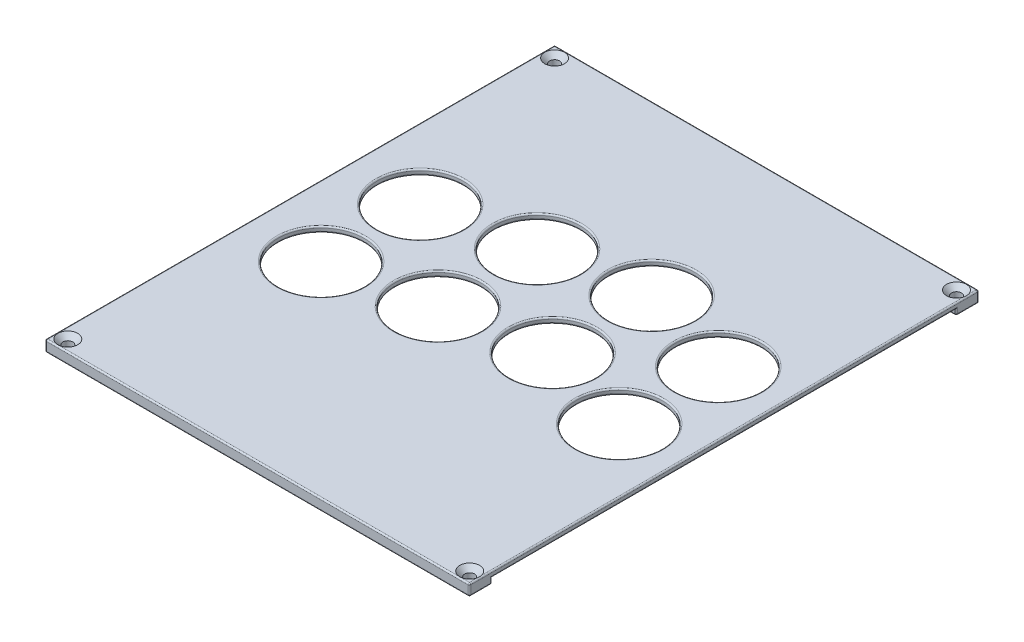
from build123d import *

# Parameters (mm, degrees)
SKETCH1_W           = 150
SKETCH1_H           = 180
SKETCH1_R           = 15.2
SKETCH1_R_2         = 1.75
BOSS_EXTRUDE1_DEPTH = 2
BOSS_EXTRUDE2_START = -2
SKETCH1_4_R         = 1.75
BOSS_EXTRUDE2_DEPTH = 2
BOSS_EXTRUDE3_DEPTH = 4
CUT_EXTRUDE1_DEPTH  = 0.1
FILLET1_R           = 0.5


with BuildPart() as part:
    # Sketch1 → Boss-Extrude1 (new body)
    with BuildSketch(Plane(origin=(0, 0, 0), x_dir=(1, 0, 0), z_dir=(0, 1, 0))):
        with Locations((-75, -90)):
            Rectangle(SKETCH1_W, SKETCH1_H)
        with Locations(Location((-125, -72.5, 0), (0, 0, 270))):
            Circle(SKETCH1_R, mode=Mode.SUBTRACT)
        with Locations(Location((-90.707143601, -65.5, 0), (0, 0, 270))):
            Circle(SKETCH1_R, mode=Mode.SUBTRACT)
        with Locations(Location((-56.225264302, -59.5, 0), (0, 0, 270))):
            Circle(SKETCH1_R, mode=Mode.SUBTRACT)
        with Locations(Location((-22.684244639, -69.5, 0), (0, 0, 270))):
            Circle(SKETCH1_R, mode=Mode.SUBTRACT)
        with Locations(Location((-22.684244639, -104.5, 0), (0, 0, 270))):
            Circle(SKETCH1_R, mode=Mode.SUBTRACT)
        with Locations(Location((-56.225264302, -94.5, 0), (0, 0, 270))):
            Circle(SKETCH1_R, mode=Mode.SUBTRACT)
        with Locations(Location((-90.707143601, -100.5, 0), (0, 0, 270))):
            Circle(SKETCH1_R, mode=Mode.SUBTRACT)
        with Locations(Location((-125, -107.5, 0), (0, 0, 270))):
            Circle(SKETCH1_R, mode=Mode.SUBTRACT)
        with Locations(Location((-146, -4, 0), (0, 0, 270))):
            Circle(SKETCH1_R_2, mode=Mode.SUBTRACT)
        with Locations(Location((-4, -4, 0), (0, 0, 270))):
            Circle(SKETCH1_R_2, mode=Mode.SUBTRACT)
        with Locations(Location((-4, -176, 0), (0, 0, 270))):
            Circle(SKETCH1_R_2, mode=Mode.SUBTRACT)
        with Locations(Location((-146, -176, 0), (0, 0, 270))):
            Circle(SKETCH1_R_2, mode=Mode.SUBTRACT)
    extrude(amount=BOSS_EXTRUDE1_DEPTH)

    # Sketch1<4> → Boss-Extrude2 (add)
    with BuildSketch(Plane(origin=(0, 0, 0), x_dir=(1, 0, 0), z_dir=(0, 1, 0)).offset(BOSS_EXTRUDE2_START)):
        Polygon((0, -8), (0, 0), (-150, 0), (-150, -180), (0, -180), (0, -172), (-8, -172), (-8, -178), (-142, -178), (-142, -172), (-148, -172), (-148, -8), (-142, -8), (-142, -2), (-8, -2), (-8, -8), align=None)
        with Locations((-146, -176)):
            Circle(SKETCH1_4_R, mode=Mode.SUBTRACT)
        with Locations((-4, -176)):
            Circle(SKETCH1_4_R, mode=Mode.SUBTRACT)
        with Locations((-146, -4)):
            Circle(SKETCH1_4_R, mode=Mode.SUBTRACT)
        with Locations((-4, -4)):
            Circle(SKETCH1_4_R, mode=Mode.SUBTRACT)
    extrude(amount=BOSS_EXTRUDE2_DEPTH)

    # Sketch1<5> → Boss-Extrude3 (add)
    with BuildSketch(Plane(origin=(0, 0, 0), x_dir=(1, 0, 0), z_dir=(0, 1, 0))):
        Polygon((-145.7, -90), (-145.7, -80), (-143.7, -80), (-143.7, -100), (-145.7, -100), align=None)
        Polygon((-75, -2.3), (-65, -2.3), (-65, -4.3), (-85, -4.3), (-85, -2.3), align=None)
        Polygon((-75, -177.7), (-65, -177.7), (-65, -175.7), (-85, -175.7), (-85, -177.7), align=None)
    extrude(amount=-BOSS_EXTRUDE3_DEPTH)

    # Sketch2 → Cut-Extrude1 (cut)
    with BuildSketch(Plane(origin=(0, 0, 0), x_dir=(0, 0, -1), z_dir=(1, 0, 0))):
        Polygon((-172, -2), (-172, 0), (-8, 0), (-8, -2), (0, -2), (0, 2), (-180, 2), (-180, -2), align=None)
    extrude(amount=-CUT_EXTRUDE1_DEPTH, mode=Mode.SUBTRACT)

    # Fillet1
    # the kernel refuses this fillet: 0.5 mm, written as the material it takes off along each edge
    with BuildSketch(Plane(origin=(-142.5, -1.5, 172.5), x_dir=(0, 0, -1), z_dir=(0, -1, 0))) as fillet1_piece_1_section:
        Polygon((0, 0), (FILLET1_R, 0), (FILLET1_R, FILLET1_R), (0, FILLET1_R), align=None)
    fillet1_piece_1 = extrude(amount=FILLET1_R, mode=Mode.PRIVATE)
    fillet1_piece_1 = fillet1_piece_1 - Plane(origin=(-142.5, -1.5, 172.5), x_dir=(-0.7071067811865492, 0, 0.7071067811865459), z_dir=(0, -1, 0)) * Sphere(FILLET1_R, mode=Mode.PRIVATE)
    add(fillet1_piece_1, mode=Mode.SUBTRACT)
    with BuildSketch(Plane(origin=(-7.5, -1.5, 172.5), x_dir=(0, -1, 0), z_dir=(-1, 0, 0))) as fillet1_piece_2_section:
        Polygon((0, 0), (FILLET1_R, 0), (FILLET1_R, -FILLET1_R), (0, -FILLET1_R), align=None)
    fillet1_piece_2 = extrude(amount=FILLET1_R, mode=Mode.PRIVATE)
    fillet1_piece_2 = fillet1_piece_2 - Plane(origin=(-7.5, -1.5, 172.5), x_dir=(0, 0.7071067811865475, 0.7071067811865475), z_dir=(-1, 0, 0)) * Sphere(FILLET1_R, mode=Mode.PRIVATE)
    add(fillet1_piece_2, mode=Mode.SUBTRACT)
    with BuildSketch(Plane(origin=(-149.5, -1.5, 0.5), x_dir=(0, -1, 0), z_dir=(0, 0, -1))) as fillet1_piece_3_section:
        Polygon((0, 0), (FILLET1_R, 0), (FILLET1_R, FILLET1_R), (0, FILLET1_R), align=None)
    fillet1_piece_3 = extrude(amount=FILLET1_R, mode=Mode.PRIVATE)
    fillet1_piece_3 = fillet1_piece_3 - Plane(origin=(-149.5, -1.5, 0.5), x_dir=(0.7071067811865475, 0.7071067811865475, 0), z_dir=(0, 0, -1)) * Sphere(FILLET1_R, mode=Mode.PRIVATE)
    add(fillet1_piece_3, mode=Mode.SUBTRACT)
    with BuildSketch(Plane(origin=(-149.5, -1.5, 179.5), x_dir=(0, -1, 0), z_dir=(0, 0, 1))) as fillet1_piece_4_section:
        Polygon((0, 0), (FILLET1_R, 0), (FILLET1_R, -FILLET1_R), (0, -FILLET1_R), align=None)
    fillet1_piece_4 = extrude(amount=FILLET1_R, mode=Mode.PRIVATE)
    fillet1_piece_4 = fillet1_piece_4 - Plane(origin=(-149.5, -1.5, 179.5), x_dir=(0.7071067811865475, 0.7071067811865475, 0), z_dir=(0, 0, 1)) * Sphere(FILLET1_R, mode=Mode.PRIVATE)
    add(fillet1_piece_4, mode=Mode.SUBTRACT)
    with BuildSketch(Plane(origin=(-7.5, -1.5, 7.5), x_dir=(0, -1, 0), z_dir=(-1, 0, 0))) as fillet1_piece_5_section:
        Polygon((0, 0), (FILLET1_R, 0), (FILLET1_R, FILLET1_R), (0, FILLET1_R), align=None)
    fillet1_piece_5 = extrude(amount=FILLET1_R, mode=Mode.PRIVATE)
    fillet1_piece_5 = fillet1_piece_5 - Plane(origin=(-7.5, -1.5, 7.5), x_dir=(0, 0.7071067811865475, -0.7071067811865475), z_dir=(-1, 0, 0)) * Sphere(FILLET1_R, mode=Mode.PRIVATE)
    add(fillet1_piece_5, mode=Mode.SUBTRACT)
    with BuildSketch(Plane(origin=(-0.6, -1.5, 7.5), x_dir=(0, -1, 0), z_dir=(1, 0, 0))) as fillet1_piece_6_section:
        Polygon((0, 0), (FILLET1_R, 0), (FILLET1_R, -FILLET1_R), (0, -FILLET1_R), align=None)
    fillet1_piece_6 = extrude(amount=FILLET1_R, mode=Mode.PRIVATE)
    fillet1_piece_6 = fillet1_piece_6 - Plane(origin=(-0.6, -1.5, 7.5), x_dir=(0, 0.7071067811865475, -0.7071067811865475), z_dir=(1, 0, 0)) * Sphere(FILLET1_R, mode=Mode.PRIVATE)
    add(fillet1_piece_6, mode=Mode.SUBTRACT)
    with BuildSketch(Plane(origin=(-142.5, -1.5, 7.5), x_dir=(1, 0, 0), z_dir=(0, -1, 0))) as fillet1_piece_7_section:
        Polygon((0, 0), (FILLET1_R, 0), (FILLET1_R, FILLET1_R), (0, FILLET1_R), align=None)
    fillet1_piece_7 = extrude(amount=FILLET1_R, mode=Mode.PRIVATE)
    fillet1_piece_7 = fillet1_piece_7 - Plane(origin=(-142.5, -1.5, 7.5), x_dir=(-0.7071067811865475, 0, -0.7071067811865475), z_dir=(0, -1, 0)) * Sphere(FILLET1_R, mode=Mode.PRIVATE)
    add(fillet1_piece_7, mode=Mode.SUBTRACT)
    with BuildSketch(Plane(origin=(-0.6, -1.5, 172.5), x_dir=(0, -1, 0), z_dir=(1, 0, 0))) as fillet1_piece_8_section:
        Polygon((0, 0), (FILLET1_R, 0), (FILLET1_R, FILLET1_R), (0, FILLET1_R), align=None)
    fillet1_piece_8 = extrude(amount=FILLET1_R, mode=Mode.PRIVATE)
    fillet1_piece_8 = fillet1_piece_8 - Plane(origin=(-0.6, -1.5, 172.5), x_dir=(0, 0.7071067811865475, 0.7071067811865475), z_dir=(1, 0, 0)) * Sphere(FILLET1_R, mode=Mode.PRIVATE)
    add(fillet1_piece_8, mode=Mode.SUBTRACT)
    with BuildSketch(Plane(origin=(-0.6, -1.5, 179.5), x_dir=(1, 0, 0), z_dir=(0, 0, 1))) as fillet1_piece_9_section:
        Polygon((0, 0), (FILLET1_R, 0), (FILLET1_R, -FILLET1_R), (0, -FILLET1_R), align=None)
    fillet1_piece_9 = extrude(amount=FILLET1_R, mode=Mode.PRIVATE)
    fillet1_piece_9 = fillet1_piece_9 - Plane(origin=(-0.6, -1.5, 179.5), x_dir=(-0.7071067811865475, 0.7071067811865475, 0), z_dir=(0, 0, 1)) * Sphere(FILLET1_R, mode=Mode.PRIVATE)
    add(fillet1_piece_9, mode=Mode.SUBTRACT)
    with BuildSketch(Plane(origin=(-0.6, -1.5, 0.5), x_dir=(1, 0, 0), z_dir=(0, 0, -1))) as fillet1_piece_10_section:
        Polygon((0, 0), (FILLET1_R, 0), (FILLET1_R, FILLET1_R), (0, FILLET1_R), align=None)
    fillet1_piece_10 = extrude(amount=FILLET1_R, mode=Mode.PRIVATE)
    fillet1_piece_10 = fillet1_piece_10 - Plane(origin=(-0.6, -1.5, 0.5), x_dir=(-0.7071067811865475, 0.7071067811865475, 0), z_dir=(0, 0, -1)) * Sphere(FILLET1_R, mode=Mode.PRIVATE)
    add(fillet1_piece_10, mode=Mode.SUBTRACT)
    with BuildSketch(Plane(origin=(-0.6, 1.5, 0.5), x_dir=(1, 0, 0), z_dir=(0, 0, -1))) as fillet1_piece_11_section:
        Polygon((0, 0), (FILLET1_R, 0), (FILLET1_R, -FILLET1_R), (0, -FILLET1_R), align=None)
    fillet1_piece_11 = extrude(amount=FILLET1_R, mode=Mode.PRIVATE)
    fillet1_piece_11 = fillet1_piece_11 - Plane(origin=(-0.6, 1.5, 0.5), x_dir=(-0.7071067811865475, -0.7071067811865475, 0), z_dir=(0, 0, -1)) * Sphere(FILLET1_R, mode=Mode.PRIVATE)
    add(fillet1_piece_11, mode=Mode.SUBTRACT)
    with BuildSketch(Plane(origin=(-149.5, 1.5, 0.5), x_dir=(-1, 0, 0), z_dir=(0, 0, -1))) as fillet1_piece_12_section:
        Polygon((0, 0), (FILLET1_R, 0), (FILLET1_R, FILLET1_R), (0, FILLET1_R), align=None)
    fillet1_piece_12 = extrude(amount=FILLET1_R, mode=Mode.PRIVATE)
    fillet1_piece_12 = fillet1_piece_12 - Plane(origin=(-149.5, 1.5, 0.5), x_dir=(0.7071067811865475, -0.7071067811865475, 0), z_dir=(0, 0, -1)) * Sphere(FILLET1_R, mode=Mode.PRIVATE)
    add(fillet1_piece_12, mode=Mode.SUBTRACT)
    with BuildSketch(Plane(origin=(-149.5, 1.5, 179.5), x_dir=(-1, 0, 0), z_dir=(0, 0, 1))) as fillet1_piece_13_section:
        Polygon((0, 0), (FILLET1_R, 0), (FILLET1_R, -FILLET1_R), (0, -FILLET1_R), align=None)
    fillet1_piece_13 = extrude(amount=FILLET1_R, mode=Mode.PRIVATE)
    fillet1_piece_13 = fillet1_piece_13 - Plane(origin=(-149.5, 1.5, 179.5), x_dir=(0.7071067811865475, -0.7071067811865475, 0), z_dir=(0, 0, 1)) * Sphere(FILLET1_R, mode=Mode.PRIVATE)
    add(fillet1_piece_13, mode=Mode.SUBTRACT)
    with BuildSketch(Plane(origin=(-0.6, 1.5, 179.5), x_dir=(1, 0, 0), z_dir=(0, 0, 1))) as fillet1_piece_14_section:
        Polygon((0, 0), (FILLET1_R, 0), (FILLET1_R, FILLET1_R), (0, FILLET1_R), align=None)
    fillet1_piece_14 = extrude(amount=FILLET1_R, mode=Mode.PRIVATE)
    fillet1_piece_14 = fillet1_piece_14 - Plane(origin=(-0.6, 1.5, 179.5), x_dir=(-0.7071067811865475, -0.7071067811865475, 0), z_dir=(0, 0, 1)) * Sphere(FILLET1_R, mode=Mode.PRIVATE)
    add(fillet1_piece_14, mode=Mode.SUBTRACT)
    with BuildSketch(Plane(origin=(-142, -2, 178), x_dir=(-1, 0, 0), z_dir=(0, 0, -1)), Plane(origin=(-8, -2, 172.5), x_dir=(1, 0, 0), z_dir=(0, 0, 1)), Plane(origin=(-8, -2, 2), x_dir=(1, 0, 0), z_dir=(0, 0, 1)), Plane(origin=(-142.5, -2, 172), x_dir=(0, 0, 1), z_dir=(-1, 0, 0)), Plane(origin=(-142, -2, 7.5), x_dir=(-1, 0, 0), z_dir=(0, 0, -1)), Plane(origin=(-148, -2, 8), x_dir=(0, 0, -1), z_dir=(1, 0, 0))) as fillet1_piece_15:
        with BuildLine():
            CenterArc((FILLET1_R, FILLET1_R), FILLET1_R, 180, 90)
            Line((0, FILLET1_R), (0, 0))
            Line((0, 0), (FILLET1_R, 0))
        make_face()
    extrude(amount=5.5, mode=Mode.SUBTRACT)
    with BuildSketch(Plane(origin=(-142, -1.5, 172), x_dir=(-1, 0, 0), z_dir=(0, 1, 0)), Plane(origin=(-8, -1.5, 8), x_dir=(1, 0, 0), z_dir=(0, 1, 0)), Plane(origin=(-142, -1.5, 8), x_dir=(0, 0, -1), z_dir=(0, 1, 0))) as fillet1_piece_16:
        with BuildLine():
            CenterArc((FILLET1_R, FILLET1_R), FILLET1_R, 180, 90)
            Line((0, FILLET1_R), (0, 0))
            Line((0, 0), (FILLET1_R, 0))
        make_face()
    extrude(amount=1.5, mode=Mode.SUBTRACT)
    with BuildSketch(Plane(origin=(-8, -1.5, 172), x_dir=(1, 0, 0), z_dir=(0, 1, 0)), Plane(origin=(-0.1, -1.5, 172), x_dir=(0, 0, 1), z_dir=(0, 1, 0)), Plane(origin=(-0.1, 0, 8), x_dir=(0, 0, -1), z_dir=(0, -1, 0))) as fillet1_piece_17:
        with BuildLine():
            CenterArc((FILLET1_R, -FILLET1_R), FILLET1_R, 90, 90)
            Line((0, -FILLET1_R), (0, 0))
            Line((0, 0), (FILLET1_R, 0))
        make_face()
    extrude(amount=1.5, mode=Mode.SUBTRACT)
    with BuildSketch(Plane(origin=(-150, -2, 0.5), x_dir=(1, 0, 0), z_dir=(0, 0, 1)), Plane(origin=(-150, 2, 0.5), x_dir=(0, -1, 0), z_dir=(0, 0, 1))) as fillet1_piece_18:
        with BuildLine():
            CenterArc((FILLET1_R, FILLET1_R), FILLET1_R, 180, 90)
            Line((0, FILLET1_R), (0, 0))
            Line((0, 0), (FILLET1_R, 0))
        make_face()
    extrude(amount=179, mode=Mode.SUBTRACT)
    with BuildSketch(Plane(origin=(-7.5, -2, 8), x_dir=(0, 0, -1), z_dir=(1, 0, 0)), Plane(origin=(-0.6, -2, 172), x_dir=(0, 0, 1), z_dir=(-1, 0, 0))) as fillet1_piece_19:
        with BuildLine():
            CenterArc((FILLET1_R, FILLET1_R), FILLET1_R, 180, 90)
            Line((0, FILLET1_R), (0, 0))
            Line((0, 0), (FILLET1_R, 0))
        make_face()
    extrude(amount=6.9, mode=Mode.SUBTRACT)
    with BuildSketch(Plane(origin=(-142, -2, 2), x_dir=(0, 0, -1), z_dir=(1, 0, 0)), Plane(origin=(-8, -2, 178), x_dir=(0, 0, 1), z_dir=(-1, 0, 0))) as fillet1_piece_20:
        with BuildLine():
            CenterArc((FILLET1_R, FILLET1_R), FILLET1_R, 180, 90)
            Line((0, FILLET1_R), (0, 0))
            Line((0, 0), (FILLET1_R, 0))
        make_face()
    extrude(amount=134, mode=Mode.SUBTRACT)
    with BuildSketch(Plane(origin=(-146, -2, 176), x_dir=(1, 0, 0), z_dir=(0, 0, 1))) as fillet1_piece_21:
        with BuildLine():
            CenterArc((1.75 + FILLET1_R, FILLET1_R), FILLET1_R, 180, 90)
            Line((1.75, FILLET1_R), (1.75, 0))
            Line((1.75, 0), (1.75 + FILLET1_R, 0))
        make_face()
    revolve(axis=Axis((-146, -2, 176), (0, 1, 0)), mode=Mode.SUBTRACT)
    with BuildSketch(Plane(origin=(-4, -2, 176), x_dir=(1, 0, 0), z_dir=(0, 0, 1))) as fillet1_piece_22:
        with BuildLine():
            CenterArc((1.75 + FILLET1_R, FILLET1_R), FILLET1_R, 180, 90)
            Line((1.75, FILLET1_R), (1.75, 0))
            Line((1.75, 0), (1.75 + FILLET1_R, 0))
        make_face()
    revolve(axis=Axis((-4, -2, 176), (0, 1, 0)), mode=Mode.SUBTRACT)
    with BuildSketch(Plane(origin=(-4, -2, 4), x_dir=(1, 0, 0), z_dir=(0, 0, 1))) as fillet1_piece_23:
        with BuildLine():
            CenterArc((1.75 + FILLET1_R, FILLET1_R), FILLET1_R, 180, 90)
            Line((1.75, FILLET1_R), (1.75, 0))
            Line((1.75, 0), (1.75 + FILLET1_R, 0))
        make_face()
    revolve(axis=Axis((-4, -2, 4), (0, 1, 0)), mode=Mode.SUBTRACT)
    with BuildSketch(Plane(origin=(-146, -2, 4), x_dir=(1, 0, 0), z_dir=(0, 0, 1))) as fillet1_piece_24:
        with BuildLine():
            CenterArc((1.75 + FILLET1_R, FILLET1_R), FILLET1_R, 180, 90)
            Line((1.75, FILLET1_R), (1.75, 0))
            Line((1.75, 0), (1.75 + FILLET1_R, 0))
        make_face()
    revolve(axis=Axis((-146, -2, 4), (0, 1, 0)), mode=Mode.SUBTRACT)
    with BuildSketch(Plane(origin=(-148, -2, 172), x_dir=(-1, 0, 0), z_dir=(0, 0, -1))) as fillet1_piece_25:
        with BuildLine():
            CenterArc((FILLET1_R, FILLET1_R), FILLET1_R, 180, 90)
            Line((0, FILLET1_R), (0, 0))
            Line((0, 0), (FILLET1_R, 0))
        make_face()
    extrude(amount=164, mode=Mode.SUBTRACT)
    with BuildSketch(Plane(origin=(-65, -4, 178.95), x_dir=(0, 1, 0), z_dir=(0, 0, -1)), Plane(origin=(-85, -4, 174.45), x_dir=(0, 1, 0), z_dir=(0, 0, 1))) as fillet1_piece_26:
        with BuildLine():
            CenterArc((FILLET1_R, -FILLET1_R), FILLET1_R, 90, 90)
            Line((0, -FILLET1_R), (0, 0))
            Line((0, 0), (FILLET1_R, 0))
        make_face()
    extrude(amount=4.5, mode=Mode.SUBTRACT)
    with BuildSketch(Plane(origin=(-86.25, -4, 177.7), x_dir=(0, 1, 0), z_dir=(1, 0, 0)), Plane(origin=(-63.75, -4, 175.7), x_dir=(0, 1, 0), z_dir=(-1, 0, 0)), Plane(origin=(-145.7, -4, 78.75), x_dir=(0, 1, 0), z_dir=(0, 0, 1)), Plane(origin=(-63.75, -4, 2.3), x_dir=(0, 1, 0), z_dir=(-1, 0, 0))) as fillet1_piece_27:
        with BuildLine():
            CenterArc((FILLET1_R, -FILLET1_R), FILLET1_R, 90, 90)
            Line((0, -FILLET1_R), (0, 0))
            Line((0, 0), (FILLET1_R, 0))
        make_face()
    extrude(amount=22.5, mode=Mode.SUBTRACT)
    with BuildSketch(Plane(origin=(-146.95, -4, 80), x_dir=(0, 1, 0), z_dir=(1, 0, 0)), Plane(origin=(-142.45, -4, 100), x_dir=(0, 1, 0), z_dir=(-1, 0, 0)), Plane(origin=(-65, -4, 1.05), x_dir=(0, 1, 0), z_dir=(0, 0, 1)), Plane(origin=(-85, -4, 5.55), x_dir=(0, 1, 0), z_dir=(0, 0, -1))) as fillet1_piece_28:
        with BuildLine():
            CenterArc((FILLET1_R, FILLET1_R), FILLET1_R, 180, 90)
            Line((0, FILLET1_R), (0, 0))
            Line((0, 0), (FILLET1_R, 0))
        make_face()
    extrude(amount=4.5, mode=Mode.SUBTRACT)
    with BuildSketch(Plane(origin=(-143.7, -4, 78.75), x_dir=(0, 1, 0), z_dir=(0, 0, 1)), Plane(origin=(-63.75, -4, 4.3), x_dir=(0, 1, 0), z_dir=(-1, 0, 0))) as fillet1_piece_29:
        with BuildLine():
            CenterArc((FILLET1_R, FILLET1_R), FILLET1_R, 180, 90)
            Line((0, FILLET1_R), (0, 0))
            Line((0, 0), (FILLET1_R, 0))
        make_face()
    extrude(amount=22.5, mode=Mode.SUBTRACT)
    with BuildSketch(Plane(origin=(-149.5, -2, 180), x_dir=(0, 0, -1), z_dir=(1, 0, 0)), Plane(origin=(-0.6, 2, 0), x_dir=(0, -1, 0), z_dir=(-1, 0, 0))) as fillet1_piece_30:
        with BuildLine():
            CenterArc((FILLET1_R, FILLET1_R), FILLET1_R, 180, 90)
            Line((0, FILLET1_R), (0, 0))
            Line((0, 0), (FILLET1_R, 0))
        make_face()
    extrude(amount=148.9, mode=Mode.SUBTRACT)
    with BuildSketch(Plane(origin=(-0.6, -2, 0), x_dir=(0, 1, 0), z_dir=(-1, 0, 0)), Plane(origin=(-149.5, 2, 180), x_dir=(0, 0, -1), z_dir=(1, 0, 0))) as fillet1_piece_31:
        with BuildLine():
            CenterArc((FILLET1_R, -FILLET1_R), FILLET1_R, 90, 90)
            Line((0, -FILLET1_R), (0, 0))
            Line((0, 0), (FILLET1_R, 0))
        make_face()
    extrude(amount=148.9, mode=Mode.SUBTRACT)
    with BuildSketch(Plane(origin=(-0.1, -2, 179.5), x_dir=(0, 1, 0), z_dir=(0, 0, -1)), Plane(origin=(-0.1, -2, 7.5), x_dir=(0, 1, 0), z_dir=(0, 0, -1))) as fillet1_piece_32:
        with BuildLine():
            CenterArc((FILLET1_R, -FILLET1_R), FILLET1_R, 90, 90)
            Line((0, -FILLET1_R), (0, 0))
            Line((0, 0), (FILLET1_R, 0))
        make_face()
    extrude(amount=7, mode=Mode.SUBTRACT)
    with BuildSketch(Plane(origin=(-0.1, 1.5, 180), x_dir=(0, 0, -1), z_dir=(0, -1, 0)), Plane(origin=(-150, -1.5, 180), x_dir=(0, 0, -1), z_dir=(0, 1, 0)), Plane(origin=(-150, -1.5, 0), x_dir=(1, 0, 0), z_dir=(0, 1, 0))) as fillet1_piece_33:
        with BuildLine():
            CenterArc((FILLET1_R, -FILLET1_R), FILLET1_R, 90, 90)
            Line((0, -FILLET1_R), (0, 0))
            Line((0, 0), (FILLET1_R, 0))
        make_face()
    extrude(amount=3, mode=Mode.SUBTRACT)
    with BuildSketch(Plane(origin=(-0.1, 2, 0.5), x_dir=(0, -1, 0), z_dir=(0, 0, 1))) as fillet1_piece_34:
        with BuildLine():
            CenterArc((FILLET1_R, -FILLET1_R), FILLET1_R, 90, 90)
            Line((0, -FILLET1_R), (0, 0))
            Line((0, 0), (FILLET1_R, 0))
        make_face()
    extrude(amount=179, mode=Mode.SUBTRACT)
    with BuildSketch(Plane(origin=(-0.1, -1.5, 0), x_dir=(-1, 0, 0), z_dir=(0, 1, 0))) as fillet1_piece_35:
        with BuildLine():
            CenterArc((FILLET1_R, FILLET1_R), FILLET1_R, 180, 90)
            Line((0, FILLET1_R), (0, 0))
            Line((0, 0), (FILLET1_R, 0))
        make_face()
    extrude(amount=3, mode=Mode.SUBTRACT)
    with BuildSketch(Plane(origin=(-0.1, 0, 172), x_dir=(0, 1, 0), z_dir=(0, 0, -1))) as fillet1_piece_36:
        with BuildLine():
            CenterArc((FILLET1_R, -FILLET1_R), FILLET1_R, 90, 90)
            Line((0, -FILLET1_R), (0, 0))
            Line((0, 0), (FILLET1_R, 0))
        make_face()
    extrude(amount=164, mode=Mode.SUBTRACT)
    with BuildSketch(Plane(origin=(-125, 2, 107.5), x_dir=(0, 0, 1), z_dir=(-1, 0, 0))) as fillet1_piece_37:
        with BuildLine():
            CenterArc((15.2 + FILLET1_R, -FILLET1_R), FILLET1_R, 90, 90)
            Line((15.2, -FILLET1_R), (15.2, 0))
            Line((15.2, 0), (15.2 + FILLET1_R, 0))
        make_face()
    revolve(axis=Axis((-125, 2, 107.5), (0, 1, 0)), mode=Mode.SUBTRACT)
    with BuildSketch(Plane(origin=(-90.707143601, 2, 100.5), x_dir=(0, 0, 1), z_dir=(-1, 0, 0))) as fillet1_piece_38:
        with BuildLine():
            CenterArc((15.2 + FILLET1_R, -FILLET1_R), FILLET1_R, 90, 90)
            Line((15.2, -FILLET1_R), (15.2, 0))
            Line((15.2, 0), (15.2 + FILLET1_R, 0))
        make_face()
    revolve(axis=Axis((-90.707143601, 2, 100.5), (0, 1, 0)), mode=Mode.SUBTRACT)
    with BuildSketch(Plane(origin=(-56.225264302, 2, 94.5), x_dir=(0, 0, 1), z_dir=(-1, 0, 0))) as fillet1_piece_39:
        with BuildLine():
            CenterArc((15.2 + FILLET1_R, -FILLET1_R), FILLET1_R, 90, 90)
            Line((15.2, -FILLET1_R), (15.2, 0))
            Line((15.2, 0), (15.2 + FILLET1_R, 0))
        make_face()
    revolve(axis=Axis((-56.225264302, 2, 94.5), (0, 1, 0)), mode=Mode.SUBTRACT)
    with BuildSketch(Plane(origin=(-22.684244639, 2, 104.5), x_dir=(0, 0, 1), z_dir=(-1, 0, 0))) as fillet1_piece_40:
        with BuildLine():
            CenterArc((15.2 + FILLET1_R, -FILLET1_R), FILLET1_R, 90, 90)
            Line((15.2, -FILLET1_R), (15.2, 0))
            Line((15.2, 0), (15.2 + FILLET1_R, 0))
        make_face()
    revolve(axis=Axis((-22.684244639, 2, 104.5), (0, 1, 0)), mode=Mode.SUBTRACT)
    with BuildSketch(Plane(origin=(-22.684244639, 2, 69.5), x_dir=(0, 0, 1), z_dir=(-1, 0, 0))) as fillet1_piece_41:
        with BuildLine():
            CenterArc((15.2 + FILLET1_R, -FILLET1_R), FILLET1_R, 90, 90)
            Line((15.2, -FILLET1_R), (15.2, 0))
            Line((15.2, 0), (15.2 + FILLET1_R, 0))
        make_face()
    revolve(axis=Axis((-22.684244639, 2, 69.5), (0, 1, 0)), mode=Mode.SUBTRACT)
    with BuildSketch(Plane(origin=(-56.225264302, 2, 59.5), x_dir=(0, 0, 1), z_dir=(-1, 0, 0))) as fillet1_piece_42:
        with BuildLine():
            CenterArc((15.2 + FILLET1_R, -FILLET1_R), FILLET1_R, 90, 90)
            Line((15.2, -FILLET1_R), (15.2, 0))
            Line((15.2, 0), (15.2 + FILLET1_R, 0))
        make_face()
    revolve(axis=Axis((-56.225264302, 2, 59.5), (0, 1, 0)), mode=Mode.SUBTRACT)
    with BuildSketch(Plane(origin=(-125, 0, 72.5), x_dir=(0, 0, 1), z_dir=(-1, 0, 0))) as fillet1_piece_43:
        with BuildLine():
            CenterArc((15.2 + FILLET1_R, FILLET1_R), FILLET1_R, 180, 90)
            Line((15.2, FILLET1_R), (15.2, 0))
            Line((15.2, 0), (15.2 + FILLET1_R, 0))
        make_face()
    revolve(axis=Axis((-125, 0, 72.5), (0, 1, 0)), mode=Mode.SUBTRACT)
    with BuildSketch(Plane(origin=(-90.707143601, 0, 65.5), x_dir=(0, 0, 1), z_dir=(-1, 0, 0))) as fillet1_piece_44:
        with BuildLine():
            CenterArc((15.2 + FILLET1_R, FILLET1_R), FILLET1_R, 180, 90)
            Line((15.2, FILLET1_R), (15.2, 0))
            Line((15.2, 0), (15.2 + FILLET1_R, 0))
        make_face()
    revolve(axis=Axis((-90.707143601, 0, 65.5), (0, 1, 0)), mode=Mode.SUBTRACT)
    with BuildSketch(Plane(origin=(-56.225264302, 0, 59.5), x_dir=(0, 0, 1), z_dir=(-1, 0, 0))) as fillet1_piece_45:
        with BuildLine():
            CenterArc((15.2 + FILLET1_R, FILLET1_R), FILLET1_R, 180, 90)
            Line((15.2, FILLET1_R), (15.2, 0))
            Line((15.2, 0), (15.2 + FILLET1_R, 0))
        make_face()
    revolve(axis=Axis((-56.225264302, 0, 59.5), (0, 1, 0)), mode=Mode.SUBTRACT)
    with BuildSketch(Plane(origin=(-22.684244639, 0, 69.5), x_dir=(0, 0, 1), z_dir=(-1, 0, 0))) as fillet1_piece_46:
        with BuildLine():
            CenterArc((15.2 + FILLET1_R, FILLET1_R), FILLET1_R, 180, 90)
            Line((15.2, FILLET1_R), (15.2, 0))
            Line((15.2, 0), (15.2 + FILLET1_R, 0))
        make_face()
    revolve(axis=Axis((-22.684244639, 0, 69.5), (0, 1, 0)), mode=Mode.SUBTRACT)
    with BuildSketch(Plane(origin=(-22.684244639, 0, 104.5), x_dir=(0, 0, 1), z_dir=(-1, 0, 0))) as fillet1_piece_47:
        with BuildLine():
            CenterArc((15.2 + FILLET1_R, FILLET1_R), FILLET1_R, 180, 90)
            Line((15.2, FILLET1_R), (15.2, 0))
            Line((15.2, 0), (15.2 + FILLET1_R, 0))
        make_face()
    revolve(axis=Axis((-22.684244639, 0, 104.5), (0, 1, 0)), mode=Mode.SUBTRACT)
    with BuildSketch(Plane(origin=(-56.225264302, 0, 94.5), x_dir=(0, 0, 1), z_dir=(-1, 0, 0))) as fillet1_piece_48:
        with BuildLine():
            CenterArc((15.2 + FILLET1_R, FILLET1_R), FILLET1_R, 180, 90)
            Line((15.2, FILLET1_R), (15.2, 0))
            Line((15.2, 0), (15.2 + FILLET1_R, 0))
        make_face()
    revolve(axis=Axis((-56.225264302, 0, 94.5), (0, 1, 0)), mode=Mode.SUBTRACT)
    with BuildSketch(Plane(origin=(-90.707143601, 0, 100.5), x_dir=(0, 0, 1), z_dir=(-1, 0, 0))) as fillet1_piece_49:
        with BuildLine():
            CenterArc((15.2 + FILLET1_R, FILLET1_R), FILLET1_R, 180, 90)
            Line((15.2, FILLET1_R), (15.2, 0))
            Line((15.2, 0), (15.2 + FILLET1_R, 0))
        make_face()
    revolve(axis=Axis((-90.707143601, 0, 100.5), (0, 1, 0)), mode=Mode.SUBTRACT)
    with BuildSketch(Plane(origin=(-90.707143601, 2, 65.5), x_dir=(0, 0, 1), z_dir=(-1, 0, 0))) as fillet1_piece_50:
        with BuildLine():
            CenterArc((15.2 + FILLET1_R, -FILLET1_R), FILLET1_R, 90, 90)
            Line((15.2, -FILLET1_R), (15.2, 0))
            Line((15.2, 0), (15.2 + FILLET1_R, 0))
        make_face()
    revolve(axis=Axis((-90.707143601, 2, 65.5), (0, 1, 0)), mode=Mode.SUBTRACT)
    with BuildSketch(Plane(origin=(-125, 0, 107.5), x_dir=(0, 0, 1), z_dir=(-1, 0, 0))) as fillet1_piece_51:
        with BuildLine():
            CenterArc((15.2 + FILLET1_R, FILLET1_R), FILLET1_R, 180, 90)
            Line((15.2, FILLET1_R), (15.2, 0))
            Line((15.2, 0), (15.2 + FILLET1_R, 0))
        make_face()
    revolve(axis=Axis((-125, 0, 107.5), (0, 1, 0)), mode=Mode.SUBTRACT)
    with BuildSketch(Plane(origin=(-125, 2, 72.5), x_dir=(0, 0, 1), z_dir=(-1, 0, 0))) as fillet1_piece_52:
        with BuildLine():
            CenterArc((15.2 + FILLET1_R, -FILLET1_R), FILLET1_R, 90, 90)
            Line((15.2, -FILLET1_R), (15.2, 0))
            Line((15.2, 0), (15.2 + FILLET1_R, 0))
        make_face()
    revolve(axis=Axis((-125, 2, 72.5), (0, 1, 0)), mode=Mode.SUBTRACT)
    with BuildSketch(Plane(origin=(-142, -2, 179.25), x_dir=(-1, 0, 0), z_dir=(0, 0, -1))) as fillet1_piece_53a_section:
        with BuildLine():
            CenterArc((FILLET1_R, FILLET1_R), FILLET1_R, 180, 90)
            Line((0, FILLET1_R), (0, 0))
            Line((0, 0), (FILLET1_R, 0))
        make_face()
    fillet1_piece_53a = extrude(amount=6.75, mode=Mode.PRIVATE)
    fillet1_piece_53a = split(fillet1_piece_53a, bisect_by=Plane(origin=(-142, -2, 178), z_dir=(0, 0, 1)), keep=Keep.TOP, mode=Mode.PRIVATE)
    with BuildSketch(Plane(origin=(-8, -2, 178), x_dir=(0, 0, 1), z_dir=(-1, 0, 0))) as fillet1_piece_53b_section:
        with BuildLine():
            CenterArc((FILLET1_R, FILLET1_R), FILLET1_R, 180, 90)
            Line((0, FILLET1_R), (0, 0))
            Line((0, 0), (FILLET1_R, 0))
        make_face()
    fillet1_piece_53b = extrude(amount=135.25, mode=Mode.PRIVATE)
    fillet1_piece_53b = split(fillet1_piece_53b, bisect_by=Plane(origin=(-142, -2, 178), z_dir=(-1, 0, 0)), keep=Keep.TOP, mode=Mode.PRIVATE)
    fillet1_piece_53 = fillet1_piece_53a & fillet1_piece_53b
    add(fillet1_piece_53, mode=Mode.SUBTRACT)
    with BuildSketch(Plane(origin=(-6.75, -2, 178), x_dir=(0, 0, 1), z_dir=(-1, 0, 0))) as fillet1_piece_54a_section:
        with BuildLine():
            CenterArc((FILLET1_R, FILLET1_R), FILLET1_R, 180, 90)
            Line((0, FILLET1_R), (0, 0))
            Line((0, 0), (FILLET1_R, 0))
        make_face()
    fillet1_piece_54a = extrude(amount=135.25, mode=Mode.PRIVATE)
    fillet1_piece_54a = split(fillet1_piece_54a, bisect_by=Plane(origin=(-8, -2, 178), z_dir=(1, 0, 0)), keep=Keep.TOP, mode=Mode.PRIVATE)
    with BuildSketch(Plane(origin=(-8, -2, 172.5), x_dir=(1, 0, 0), z_dir=(0, 0, 1))) as fillet1_piece_54b_section:
        with BuildLine():
            CenterArc((FILLET1_R, FILLET1_R), FILLET1_R, 180, 90)
            Line((0, FILLET1_R), (0, 0))
            Line((0, 0), (FILLET1_R, 0))
        make_face()
    fillet1_piece_54b = extrude(amount=6.75, mode=Mode.PRIVATE)
    fillet1_piece_54b = split(fillet1_piece_54b, bisect_by=Plane(origin=(-8, -2, 178), z_dir=(0, 0, 1)), keep=Keep.TOP, mode=Mode.PRIVATE)
    fillet1_piece_54 = fillet1_piece_54a & fillet1_piece_54b
    add(fillet1_piece_54, mode=Mode.SUBTRACT)
    with BuildSketch(Plane(origin=(-8, -2, 0.75), x_dir=(1, 0, 0), z_dir=(0, 0, 1))) as fillet1_piece_55a_section:
        with BuildLine():
            CenterArc((FILLET1_R, FILLET1_R), FILLET1_R, 180, 90)
            Line((0, FILLET1_R), (0, 0))
            Line((0, 0), (FILLET1_R, 0))
        make_face()
    fillet1_piece_55a = extrude(amount=6.75, mode=Mode.PRIVATE)
    fillet1_piece_55a = split(fillet1_piece_55a, bisect_by=Plane(origin=(-8, -2, 2), z_dir=(0, 0, -1)), keep=Keep.TOP, mode=Mode.PRIVATE)
    with BuildSketch(Plane(origin=(-142, -2, 2), x_dir=(0, 0, -1), z_dir=(1, 0, 0))) as fillet1_piece_55b_section:
        with BuildLine():
            CenterArc((FILLET1_R, FILLET1_R), FILLET1_R, 180, 90)
            Line((0, FILLET1_R), (0, 0))
            Line((0, 0), (FILLET1_R, 0))
        make_face()
    fillet1_piece_55b = extrude(amount=135.25, mode=Mode.PRIVATE)
    fillet1_piece_55b = split(fillet1_piece_55b, bisect_by=Plane(origin=(-8, -2, 2), z_dir=(1, 0, 0)), keep=Keep.TOP, mode=Mode.PRIVATE)
    fillet1_piece_55 = fillet1_piece_55a & fillet1_piece_55b
    add(fillet1_piece_55, mode=Mode.SUBTRACT)
    with BuildSketch(Plane(origin=(-143.25, -2, 2), x_dir=(0, 0, -1), z_dir=(1, 0, 0))) as fillet1_piece_56a_section:
        with BuildLine():
            CenterArc((FILLET1_R, FILLET1_R), FILLET1_R, 180, 90)
            Line((0, FILLET1_R), (0, 0))
            Line((0, 0), (FILLET1_R, 0))
        make_face()
    fillet1_piece_56a = extrude(amount=135.25, mode=Mode.PRIVATE)
    fillet1_piece_56a = split(fillet1_piece_56a, bisect_by=Plane(origin=(-142, -2, 2), z_dir=(-1, 0, 0)), keep=Keep.TOP, mode=Mode.PRIVATE)
    with BuildSketch(Plane(origin=(-142, -2, 7.5), x_dir=(-1, 0, 0), z_dir=(0, 0, -1))) as fillet1_piece_56b_section:
        with BuildLine():
            CenterArc((FILLET1_R, FILLET1_R), FILLET1_R, 180, 90)
            Line((0, FILLET1_R), (0, 0))
            Line((0, 0), (FILLET1_R, 0))
        make_face()
    fillet1_piece_56b = extrude(amount=6.75, mode=Mode.PRIVATE)
    fillet1_piece_56b = split(fillet1_piece_56b, bisect_by=Plane(origin=(-142, -2, 2), z_dir=(0, 0, -1)), keep=Keep.TOP, mode=Mode.PRIVATE)
    fillet1_piece_56 = fillet1_piece_56a & fillet1_piece_56b
    add(fillet1_piece_56, mode=Mode.SUBTRACT)
    with BuildSketch(Plane(origin=(-148, -2, 173.25), x_dir=(-1, 0, 0), z_dir=(0, 0, -1))) as fillet1_piece_57a_section:
        with BuildLine():
            CenterArc((FILLET1_R, FILLET1_R), FILLET1_R, 180, 90)
            Line((0, FILLET1_R), (0, 0))
            Line((0, 0), (FILLET1_R, 0))
        make_face()
    fillet1_piece_57a = extrude(amount=165.25, mode=Mode.PRIVATE)
    fillet1_piece_57a = split(fillet1_piece_57a, bisect_by=Plane(origin=(-148, -2, 172), z_dir=(0, 0, 1)), keep=Keep.TOP, mode=Mode.PRIVATE)
    with BuildSketch(Plane(origin=(-142.5, -2, 172), x_dir=(0, 0, 1), z_dir=(-1, 0, 0))) as fillet1_piece_57b_section:
        with BuildLine():
            CenterArc((FILLET1_R, FILLET1_R), FILLET1_R, 180, 90)
            Line((0, FILLET1_R), (0, 0))
            Line((0, 0), (FILLET1_R, 0))
        make_face()
    fillet1_piece_57b = extrude(amount=6.75, mode=Mode.PRIVATE)
    fillet1_piece_57b = split(fillet1_piece_57b, bisect_by=Plane(origin=(-148, -2, 172), z_dir=(-1, 0, 0)), keep=Keep.TOP, mode=Mode.PRIVATE)
    fillet1_piece_57 = fillet1_piece_57a & fillet1_piece_57b
    add(fillet1_piece_57, mode=Mode.SUBTRACT)
    with BuildSketch(Plane(origin=(-149.25, -2, 8), x_dir=(0, 0, -1), z_dir=(1, 0, 0))) as fillet1_piece_58a_section:
        with BuildLine():
            CenterArc((FILLET1_R, FILLET1_R), FILLET1_R, 180, 90)
            Line((0, FILLET1_R), (0, 0))
            Line((0, 0), (FILLET1_R, 0))
        make_face()
    fillet1_piece_58a = extrude(amount=6.75, mode=Mode.PRIVATE)
    fillet1_piece_58a = split(fillet1_piece_58a, bisect_by=Plane(origin=(-148, -2, 8), z_dir=(-1, 0, 0)), keep=Keep.TOP, mode=Mode.PRIVATE)
    with BuildSketch(Plane(origin=(-148, -2, 172), x_dir=(-1, 0, 0), z_dir=(0, 0, -1))) as fillet1_piece_58b_section:
        with BuildLine():
            CenterArc((FILLET1_R, FILLET1_R), FILLET1_R, 180, 90)
            Line((0, FILLET1_R), (0, 0))
            Line((0, 0), (FILLET1_R, 0))
        make_face()
    fillet1_piece_58b = extrude(amount=165.25, mode=Mode.PRIVATE)
    fillet1_piece_58b = split(fillet1_piece_58b, bisect_by=Plane(origin=(-148, -2, 8), z_dir=(0, 0, -1)), keep=Keep.TOP, mode=Mode.PRIVATE)
    fillet1_piece_58 = fillet1_piece_58a & fillet1_piece_58b
    add(fillet1_piece_58, mode=Mode.SUBTRACT)
    with BuildSketch(Plane(origin=(-0.1, -1.5, 172), x_dir=(0, 0, 1), z_dir=(0, 1, 0))) as fillet1_piece_59a_section:
        with BuildLine():
            CenterArc((FILLET1_R, -FILLET1_R), FILLET1_R, 90, 90)
            Line((0, -FILLET1_R), (0, 0))
            Line((0, 0), (FILLET1_R, 0))
        make_face()
    fillet1_piece_59a = extrude(amount=2.75, mode=Mode.PRIVATE)
    fillet1_piece_59a = split(fillet1_piece_59a, bisect_by=Plane(origin=(-0.1, 0, 172), z_dir=(0, 1, 0)), keep=Keep.TOP, mode=Mode.PRIVATE)
    with BuildSketch(Plane(origin=(-0.1, 0, 173.25), x_dir=(0, 1, 0), z_dir=(0, 0, -1))) as fillet1_piece_59b_section:
        with BuildLine():
            CenterArc((FILLET1_R, -FILLET1_R), FILLET1_R, 90, 90)
            Line((0, -FILLET1_R), (0, 0))
            Line((0, 0), (FILLET1_R, 0))
        make_face()
    fillet1_piece_59b = extrude(amount=165.25, mode=Mode.PRIVATE)
    fillet1_piece_59b = split(fillet1_piece_59b, bisect_by=Plane(origin=(-0.1, 0, 172), z_dir=(0, 0, 1)), keep=Keep.TOP, mode=Mode.PRIVATE)
    fillet1_piece_59 = fillet1_piece_59a & fillet1_piece_59b
    add(fillet1_piece_59, mode=Mode.SUBTRACT)
    with BuildSketch(Plane(origin=(-0.1, 0, 172), x_dir=(0, 1, 0), z_dir=(0, 0, -1))) as fillet1_piece_60a_section:
        with BuildLine():
            CenterArc((FILLET1_R, -FILLET1_R), FILLET1_R, 90, 90)
            Line((0, -FILLET1_R), (0, 0))
            Line((0, 0), (FILLET1_R, 0))
        make_face()
    fillet1_piece_60a = extrude(amount=165.25, mode=Mode.PRIVATE)
    fillet1_piece_60a = split(fillet1_piece_60a, bisect_by=Plane(origin=(-0.1, 0, 8), z_dir=(0, 0, -1)), keep=Keep.TOP, mode=Mode.PRIVATE)
    with BuildSketch(Plane(origin=(-0.1, 1.25, 8), x_dir=(0, 0, -1), z_dir=(0, -1, 0))) as fillet1_piece_60b_section:
        with BuildLine():
            CenterArc((FILLET1_R, -FILLET1_R), FILLET1_R, 90, 90)
            Line((0, -FILLET1_R), (0, 0))
            Line((0, 0), (FILLET1_R, 0))
        make_face()
    fillet1_piece_60b = extrude(amount=2.75, mode=Mode.PRIVATE)
    fillet1_piece_60b = split(fillet1_piece_60b, bisect_by=Plane(origin=(-0.1, 0, 8), z_dir=(0, 1, 0)), keep=Keep.TOP, mode=Mode.PRIVATE)
    fillet1_piece_60 = fillet1_piece_60a & fillet1_piece_60b
    add(fillet1_piece_60, mode=Mode.SUBTRACT)

    # Chamfer1: read off the stored shape, not the designer's step
    # Chamfer1: loft between two sections, ruled curve by curve
    chamfer1_from = [
        Edge.make_three_point_arc((-146, 0.25, 177.75), (-144.25, 0.25, 176), (-146, 0.25, 174.25)),
        Edge.make_three_point_arc((-146, 0.25, 174.25), (-147.75, 0.25, 176), (-146, 0.25, 177.75)),
    ]
    chamfer1_to = [
        Edge.make_three_point_arc((-146, 2, 179.5), (-142.5, 2, 176), (-146, 2, 172.5)),
        Edge.make_three_point_arc((-146, 2, 172.5), (-149.5, 2, 176), (-146, 2, 179.5)),
    ]
    chamfer1 = Solid(Shell([*[Face.make_surface_from_curves(chamfer1_from[k], chamfer1_to[k]) for k in range(2)], Face(Wire(chamfer1_from)), Face(Wire(chamfer1_to))]))
    add(chamfer1, mode=Mode.SUBTRACT)

    # Chamfer1 2: loft between two sections, ruled curve by curve
    chamfer1_2_from = [
        Edge.make_three_point_arc((-4, 0.25, 177.75), (-2.25, 0.25, 176), (-4, 0.25, 174.25)),
        Edge.make_three_point_arc((-4, 0.25, 174.25), (-5.75, 0.25, 176), (-4, 0.25, 177.75)),
    ]
    chamfer1_2_to = [
        Edge.make_three_point_arc((-4, 2, 179.5), (-0.5, 2, 176), (-4, 2, 172.5)),
        Edge.make_three_point_arc((-4, 2, 172.5), (-7.5, 2, 176), (-4, 2, 179.5)),
    ]
    chamfer1_2 = Solid(Shell([*[Face.make_surface_from_curves(chamfer1_2_from[k], chamfer1_2_to[k]) for k in range(2)], Face(Wire(chamfer1_2_from)), Face(Wire(chamfer1_2_to))]))
    add(chamfer1_2, mode=Mode.SUBTRACT)

    # Chamfer1 3: loft between two sections, ruled curve by curve
    chamfer1_3_from = [
        Edge.make_three_point_arc((-4, 0.25, 5.75), (-2.25, 0.25, 4), (-4, 0.25, 2.25)),
        Edge.make_three_point_arc((-4, 0.25, 2.25), (-5.75, 0.25, 4), (-4, 0.25, 5.75)),
    ]
    chamfer1_3_to = [
        Edge.make_three_point_arc((-4, 2, 7.5), (-0.5, 2, 4), (-4, 2, 0.5)),
        Edge.make_three_point_arc((-4, 2, 0.5), (-7.5, 2, 4), (-4, 2, 7.5)),
    ]
    chamfer1_3 = Solid(Shell([*[Face.make_surface_from_curves(chamfer1_3_from[k], chamfer1_3_to[k]) for k in range(2)], Face(Wire(chamfer1_3_from)), Face(Wire(chamfer1_3_to))]))
    add(chamfer1_3, mode=Mode.SUBTRACT)

    # Chamfer1 4: loft between two sections, ruled curve by curve
    chamfer1_4_from = [
        Edge.make_three_point_arc((-146, 0.25, 5.75), (-144.25, 0.25, 4), (-146, 0.25, 2.25)),
        Edge.make_three_point_arc((-146, 0.25, 2.25), (-147.75, 0.25, 4), (-146, 0.25, 5.75)),
    ]
    chamfer1_4_to = [
        Edge.make_three_point_arc((-146, 2, 7.5), (-142.5, 2, 4), (-146, 2, 0.5)),
        Edge.make_three_point_arc((-146, 2, 0.5), (-149.5, 2, 4), (-146, 2, 7.5)),
    ]
    chamfer1_4 = Solid(Shell([*[Face.make_surface_from_curves(chamfer1_4_from[k], chamfer1_4_to[k]) for k in range(2)], Face(Wire(chamfer1_4_from)), Face(Wire(chamfer1_4_to))]))
    add(chamfer1_4, mode=Mode.SUBTRACT)


solid = part.part
